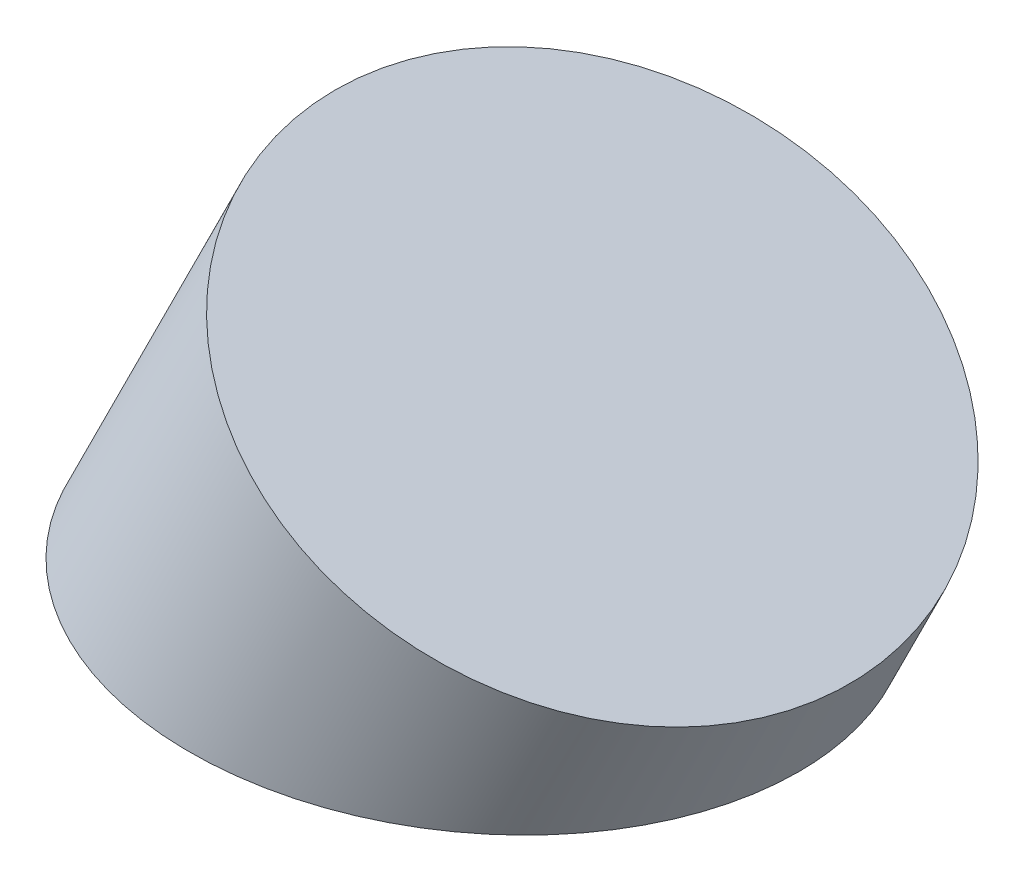
from build123d import *

# Parameters (mm, degrees)
BOSS_EXTRUDE1_DEPTH      = 33.02
BOSS_EXTRUDE1_DEPTH_BACK = 33.02
SKETCH2_W                = 56.796126629
SKETCH2_H                = 66.04
SKETCH2_R                = 15.875
CUT_EXTRUDE1_DEPTH       = 32.004


with BuildPart() as part:
    # Sketch1 → Boss-Extrude1 (new, two sides: drawn at the far end of the back side and taken through both)
    with BuildSketch(Plane.XY.offset(-BOSS_EXTRUDE1_DEPTH_BACK)):
        Polygon((0, 0), (50.8, 0), (0, 25.4), align=None)
    extrude(amount=BOSS_EXTRUDE1_DEPTH + BOSS_EXTRUDE1_DEPTH_BACK)

    # Sketch2 → Cut-Extrude1 (cut)
    with BuildSketch(Plane(origin=(10.16, 20.32, 0), x_dir=(0.8944271909999159, -0.44721359549995804, 0), z_dir=(0.44721359549995804, 0.8944271909999159, 0))):
        with Locations((17.038837989, 0)):
            Rectangle(SKETCH2_W, SKETCH2_H)
        with Locations((17.038837989, 0)):
            Circle(SKETCH2_R, mode=Mode.SUBTRACT)
    extrude(amount=-CUT_EXTRUDE1_DEPTH, mode=Mode.SUBTRACT)


solid = part.part
